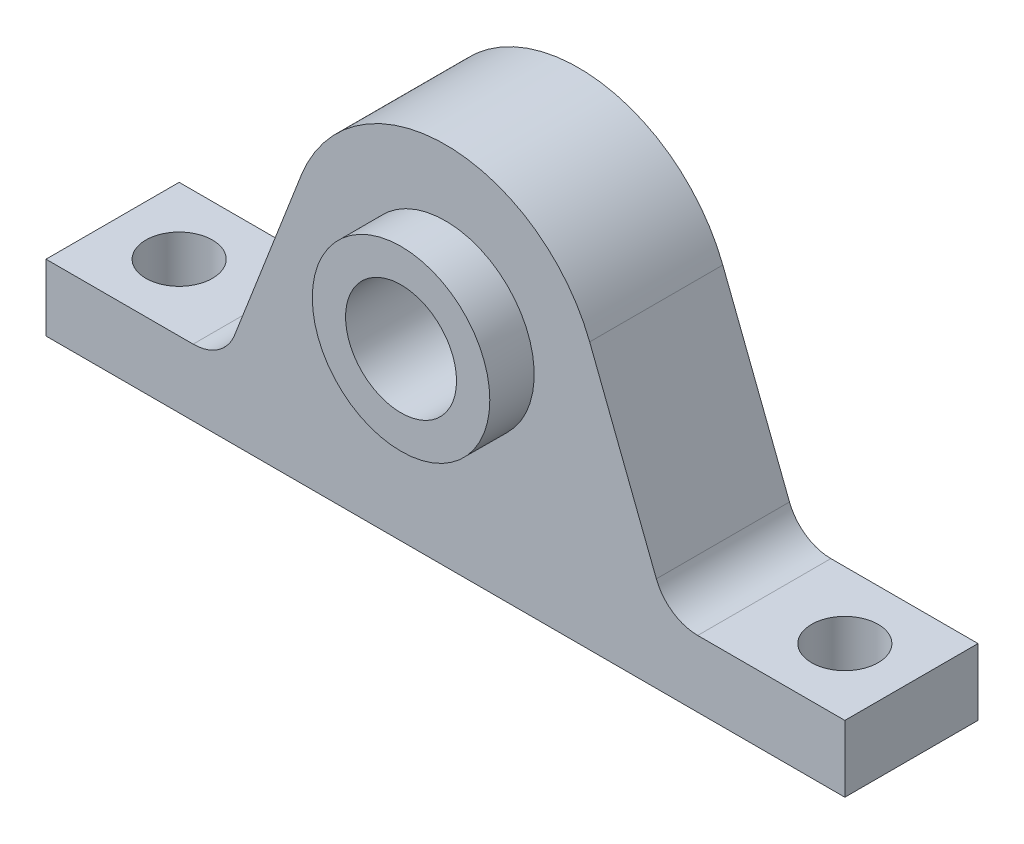
from build123d import *

# Parameters (mm, degrees)
EXTRUDE1_DEPTH     = 9.525
FILLET1_R          = 6.35
SKETCH2_R          = 12.7
EXTRUDE2_DEPTH     = 15.875
SKETCH3_R          = 7.9375
CUT_EXTRUDE1_DEPTH = 84.721758197
SKETCH4_R          = 4.7625
CUT_EXTRUDE2_DEPTH = 74.128123486


with BuildPart() as part:
    # Sketch1 → Extrude1 (new, symmetric)
    with BuildSketch(Plane.XY):
        with BuildLine():
            Line((-57.15, 0), (57.15, 0))
            Line((57.15, 0), (57.15, 9.525))
            Line((57.15, 9.525), (31.75, 9.525))
            Line((31.75, 9.525), (20.6375, 38.168891754))
            ThreePointArc((20.6375, 38.168891754), (0, 52.298640476), (-20.6375, 38.168891754))
            Line((-20.6375, 38.168891754), (-31.75, 9.525))
            Line((-31.75, 9.525), (-57.15, 9.525))
            Line((-57.15, 9.525), (-57.15, 0))
        make_face()
    extrude(amount=EXTRUDE1_DEPTH, both=True)

    # Fillet1
    fillet1_edges = [part.edges().sort_by_distance(p)[0] for p in [
        (-31.75, 9.525, 0),
        (31.75, 9.525, 0),
    ]]
    fillet(fillet1_edges, radius=FILLET1_R)

    # Sketch2 → Extrude2 (add, symmetric)
    with BuildSketch(Plane.XY):
        with Locations((0, 30.1625)):
            Circle(SKETCH2_R)
    extrude(amount=EXTRUDE2_DEPTH, both=True)

    # Sketch3 → Cut-Extrude1 (cut, through all)
    with BuildSketch(Plane.XY.offset(15.875)):
        with Locations((0, 30.1625)):
            Circle(SKETCH3_R)
    extrude(amount=-CUT_EXTRUDE1_DEPTH, mode=Mode.SUBTRACT)

    # Sketch4 → Cut-Extrude2 (cut, through all)
    with BuildSketch(Plane(origin=(0, 9.525, 0), x_dir=(-1, 0, 0), z_dir=(0, 1, 0))):
        with Locations((-47.625, 0)):
            Circle(SKETCH4_R)
        with Locations((47.625, 0)):
            Circle(SKETCH4_R)
    extrude(amount=-CUT_EXTRUDE2_DEPTH, mode=Mode.SUBTRACT)


solid = part.part
